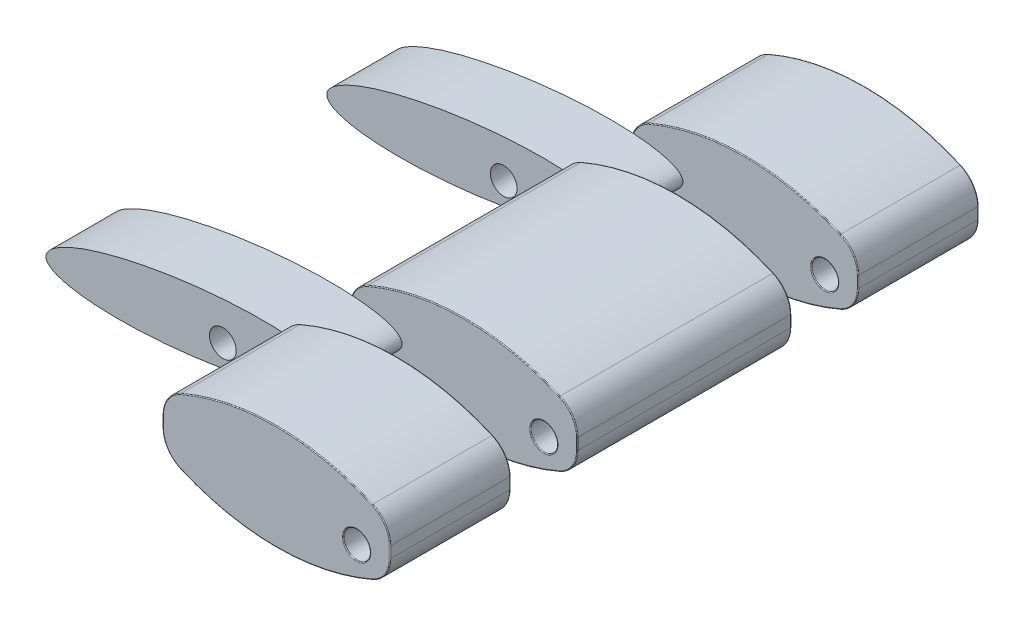
from build123d import *

# Parameters (mm, degrees)
BOSS_EXTRUDE1_DEPTH     = 22
FILLET1_R               = 1.1
SKETCH2_R               = 0.5
CUT_EXTRUDE1_DEPTH      = 22
CUT_EXTRUDE2_START      = -4.5
SKETCH3_W               = 10.029812168
SKETCH3_H               = 5.891166556
CUT_EXTRUDE2_DEPTH      = 2.5
CUT_EXTRUDE3_START      = -4.5
SKETCH4_W               = 10.428053264
SKETCH4_H               = 5.689033296
CUT_EXTRUDE3_DEPTH      = 2.5
BOSS_EXTRUDE3_START     = -4.5
SKETCH5_RX              = 5.448451499
SKETCH5_RY              = 1.147366894
BOSS_EXTRUDE3_DEPTH     = 2.5
BOSS_EXTRUDE4_START     = -17.5
SKETCH5_2_RX            = 5.448451499
SKETCH5_2_RY            = 1.147366894
BOSS_EXTRUDE4_DEPTH     = 2.5
SKETCH6_R               = 0.5
CUT_EXTRUDE4_DEPTH      = 22.5
FILLET2_R               = 0.03
FILLET4_R               = 0.03
FILLET5_R               = 0.03
FILLET6_R               = 0.03
FILLET7_R               = 0.03
CUT_EXTRUDE5_REACH      = 37.691
CUT_EXTRUDE5_END_RADIUS = 8.8
CUT_EXTRUDE5_START      = -10
FILLET8_R               = 0.02


with BuildPart() as part:
    # Sketch1 → Boss-Extrude1 (new body)
    with BuildSketch(Plane.XY):
        with BuildLine():
            Line((-4.25, 0.9), (-4.25, -0.9))
            ThreePointArc((-4.25, -0.9), (0, -1.966684174), (4.25, -0.9))
            Line((4.25, -0.9), (4.25, 0.9))
            ThreePointArc((4.25, 0.9), (0, 1.966684174), (-4.25, 0.9))
        make_face()
    extrude(amount=BOSS_EXTRUDE1_DEPTH)

    # Fillet1
    fillet1_edges = [part.edges().sort_by_distance(p)[0] for p in [
        (4.25, 0.9, 11),
        (4.25, -0.9, 11),
        (-4.25, -0.9, 11),
        (-4.25, 0.9, 11),
    ]]
    fillet(fillet1_edges, radius=FILLET1_R)

    # Sketch2 → Cut-Extrude1 (cut)
    with BuildSketch(Plane.XY.offset(22)):
        with Locations((3, -0.382032716)):
            Circle(SKETCH2_R)
    extrude(amount=-CUT_EXTRUDE1_DEPTH, mode=Mode.SUBTRACT)

    # Sketch3 → Cut-Extrude2 (cut)
    with BuildSketch(Plane.XY.offset(22).offset(CUT_EXTRUDE2_START)):
        with Locations((0.256137676, 0.620122795)):
            Rectangle(SKETCH3_W, SKETCH3_H)
    extrude(amount=-CUT_EXTRUDE2_DEPTH, mode=Mode.SUBTRACT)


with BuildPart() as cut_extrude2_piece_1:
    # of the separate pieces the step leaves, piece 1, a body of its own (cut_extrude2_pieces)
    add(part.part.solids().sort_by_distance((-4.25, 0.211509913, 0))[0])

    # Sketch4 → Cut-Extrude3 (cut)
    with BuildSketch(Plane(origin=(0, 0, 0), x_dir=(-1, 0, 0), z_dir=(0, 0, -1)).offset(CUT_EXTRUDE3_START)):
        with Locations((-0.123577677, 0.056742799)):
            Rectangle(SKETCH4_W, SKETCH4_H)
    extrude(amount=-CUT_EXTRUDE3_DEPTH, mode=Mode.SUBTRACT)


with BuildPart() as cut_extrude2_piece_2:
    # of the separate pieces the step leaves, piece 2, a body of its own (cut_extrude2_pieces)
    add(part.part.solids().sort_by_distance((-4.25, -0.211509913, 17.5))[0])

    # Fillet2
    fillet2_edges = [cut_extrude2_piece_2.edges().sort_by_distance(p)[0] for p in [
        (4.25, 0, 22),
        (0, -1.966684174, 22),
        (0, 1.966684174, 22),
        (-4.25, 0, 22),
        (-4.069909875, 0.814639935, 22),
        (-4.069909875, -0.814639935, 22),
        (4.069909875, 0.814639935, 22),
        (4.069909875, -0.814639935, 22),
        (2.5, -0.382032716, 22),
        (4.069909875, -0.814639935, 17.5),
        (-4.069909875, -0.814639935, 17.5),
        (-4.069909875, 0.814639935, 17.5),
        (4.069909875, 0.814639935, 17.5),
        (4.25, 0, 17.5),
        (0, 1.966684174, 17.5),
        (-4.25, 0, 17.5),
        (0, -1.966684174, 17.5),
        (2.5, -0.382032716, 17.5),
    ]]
    fillet(fillet2_edges, radius=FILLET2_R)

    # Cut-Extrude5: up to this cylinder (the profile starts outside it)
    cut_extrude5_end = Plane(origin=(0, 7.033315826, 19.817533), z_dir=(0, 0, -1)) * Cylinder(CUT_EXTRUDE5_END_RADIUS, 93.982, mode=Mode.PRIVATE)
    # Sketch7 → Cut-Extrude5 (cut, up to the surface)
    with BuildSketch(Plane(origin=(0, 0, 0), x_dir=(1, 0, 0), z_dir=(0, 1, 0)).offset(CUT_EXTRUDE5_START), mode=Mode.PRIVATE) as cut_extrude5_sk1:
        Polygon((-0.2, -20.884339259), (0.2, -20.884339259), (0.2, -19.384339259), (0.45, -19.384339259), (0, -18.734339259), (-0.45, -19.384339259), (-0.2, -19.384339259), align=None)
    cut_extrude5_tool1 = extrude(cut_extrude5_sk1.sketch, amount=CUT_EXTRUDE5_REACH, mode=Mode.PRIVATE) - cut_extrude5_end
    add(cut_extrude5_tool1.solids().sort_by_distance((0, -10, 19.817533))[0], mode=Mode.SUBTRACT)

    # Fillet8
    fillet8_edges = [cut_extrude2_piece_2.edges().sort_by_distance(p)[0] for p in [
        (0.2, -1.964461677, 20.134339259),
        (0, -1.966684174, 20.884339259),
        (-0.2, -1.964461677, 20.134339259),
        (-0.325031392, -1.960813069, 19.384339259),
        (-0.22507039, -1.963869474, 19.059440933),
        (0.22507039, -1.963869474, 19.059440933),
        (0.325031392, -1.960813069, 19.384339259),
        (0.325032837, -1.760679492, 19.384339259),
        (0.225073629, -1.763805399, 19.059445612),
        (-0.225073629, -1.763805399, 19.059445612),
        (-0.325032837, -1.760679492, 19.384339259),
        (-0.2, -1.764411153, 20.134339259),
        (0, -1.766684174, 20.884339259),
        (0.2, -1.764411153, 20.134339259),
    ]]
    fillet(fillet8_edges, radius=FILLET8_R - 0.0001)  # a hair under: the kernel refuses the full size


with BuildPart() as cut_extrude3_piece_1:
    # of the separate pieces the step leaves, piece 1, a body of its own (cut_extrude3_pieces)
    add(cut_extrude2_piece_1.part.solids().sort_by_distance((-4.25, 0.211509913, 7))[0])



with BuildPart() as cut_extrude3_piece_2:
    # of the separate pieces the step leaves, piece 2, a body of its own (cut_extrude3_pieces)
    add(cut_extrude2_piece_1.part.solids().sort_by_distance((-4.25, 0.211509913, 0))[0])


with BuildPart() as body_4:
    # Sketch5 → Boss-Extrude3 (new body)
    with BuildSketch(Plane.XY.offset(22).offset(BOSS_EXTRUDE3_START)):
        with Locations(Location((-7.706579751, -0.691884192), (0, 0, 7.29553487))):
            Ellipse(SKETCH5_RX, SKETCH5_RY)
    extrude(amount=-BOSS_EXTRUDE3_DEPTH)


with BuildPart() as cut_extrude3_piece_1_1:
    add(cut_extrude3_piece_1.part)

    add(cut_extrude3_piece_2.part)  # Boss-Extrude4 merges Cut-Extrude3 piece 2
    # Sketch5<2> → Boss-Extrude4 (add)
    with BuildSketch(Plane.XY.offset(22).offset(BOSS_EXTRUDE4_START)):
        with Locations(Location((-7.706579751, -0.691884192), (0, 0, 7.29553487))):
            Ellipse(SKETCH5_2_RX, SKETCH5_2_RY)
    extrude(amount=BOSS_EXTRUDE4_DEPTH)


with BuildPart() as cut_extrude4_tool:
    # Sketch6 → Cut-Extrude4 (new body)
    with BuildSketch(Plane.XY.offset(17.5)):
        with Locations((-6.5, -0.845433346)):
            Circle(SKETCH6_R)
    extrude(amount=-CUT_EXTRUDE4_DEPTH)


with BuildPart() as cut_extrude3_piece_1_2:
    add(cut_extrude3_piece_1_1.part)

    # Cut-Extrude4: cut by cut_extrude4_tool
    add(cut_extrude4_tool.part, mode=Mode.SUBTRACT)

    # Fillet4
    fillet4_edges = [cut_extrude3_piece_1_2.edges().sort_by_distance(p)[0] for p in [
        (4.25, 0, 0),
        (0, -1.966684174, 0),
        (-4.25, 0, 0),
        (0, 1.966684174, 0),
        (2.5, -0.382032716, 0),
        (4.069909875, -0.814639935, 0),
        (-4.069909875, -0.814639935, 0),
        (-4.069909875, 0.814639935, 0),
        (4.069909875, 0.814639935, 0),
    ]]
    fillet(fillet4_edges, radius=FILLET4_R)

    # Fillet5
    fillet5_edges = [cut_extrude3_piece_1_2.edges().sort_by_distance(p)[0] for p in [
        (4.069909875, -0.814639935, 15),
        (4.069909875, 0.814639935, 15),
        (-4.069909875, -0.814639935, 15),
        (-4.069909875, 0.814639935, 15),
        (2.5, -0.382032716, 4.5),
        (4.25, 0, 15),
        (0, 1.966684174, 15),
        (-4.25, 0, 15),
        (0, -1.966684174, 15),
        (2.5, -0.382032716, 15),
        (2.5, -0.382032716, 7),
    ]]
    fillet(fillet5_edges, radius=FILLET5_R)

    # Fillet6
    fillet6_edges = [cut_extrude3_piece_1_2.edges().sort_by_distance(p)[0] for p in [
        (-3.941038232, 0.975877963, 7),
        (-3.738641781, -1.14075738, 7),
        (0, -1.966684174, 7),
        (4.069909875, -0.814639935, 7),
        (4.25, 0, 7),
        (4.069909875, 0.814639935, 7),
        (0, 1.966684174, 7),
    ]]
    fillet(fillet6_edges, radius=FILLET6_R)

    # Fillet7
    fillet7_edges = [cut_extrude3_piece_1_2.edges().sort_by_distance(p)[0] for p in [
        (-3.941038232, 0.975877963, 4.5),
        (-3.738641781, -1.14075738, 4.5),
        (0, -1.966684174, 4.5),
        (4.069909875, -0.814639935, 4.5),
        (4.25, 0, 4.5),
        (4.069909875, 0.814639935, 4.5),
        (0, 1.966684174, 4.5),
    ]]
    fillet(fillet7_edges, radius=FILLET7_R)


with BuildPart() as body_4_1:
    add(body_4.part)

    # Cut-Extrude4: cut by cut_extrude4_tool
    add(cut_extrude4_tool.part, mode=Mode.SUBTRACT)


solid = Compound([cut_extrude2_piece_2.part, cut_extrude3_piece_1_2.part, body_4_1.part])
